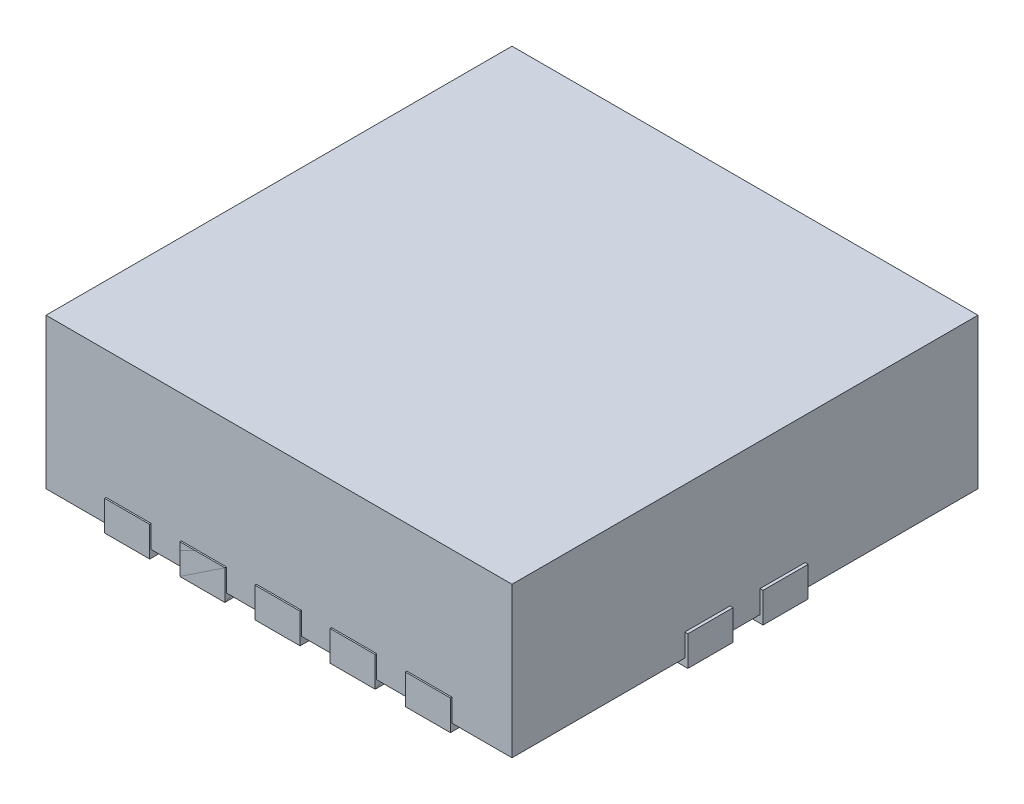
from build123d import *

# Parameters (mm, degrees)
SKETCH1_W            = 3.1
SKETCH1_H            = 3.1
BOSS_EXTRUDE1_DEPTH  = 1
BOSS_EXTRUDE2_START  = 0.05
BOSS_EXTRUDE2_DEPTH  = 0.2
BOSS_EXTRUDE3_START  = 0.05
BOSS_EXTRUDE3_DEPTH  = 0.2
BOSS_EXTRUDE4_START  = 0.05
BOSS_EXTRUDE4_DEPTH  = 0.2
LPATTERN3_COUNT      = 2
LPATTERN3_PITCH      = 0.5
MIRROR7_START        = 0.05
MIRROR7_COPY_1_DEPTH = 0.2
LPATTERN4_START      = -0.05
LPATTERN4_DEPTH      = 0.2
LPATTERN4_2_DEPTH    = 0.2
LPATTERN4_3_DEPTH    = 0.2
LPATTERN4_4_DEPTH    = 0.2
LPATTERN4_5_DEPTH    = 0.2
LPATTERN4_6_DEPTH    = 0.2
LPATTERN4_7_DEPTH    = 0.2
LPATTERN4_8_DEPTH    = 0.2
LPATTERN5_START      = -0.05
LPATTERN5_DEPTH      = 0.2
LPATTERN5_2_DEPTH    = 0.2
LPATTERN5_3_DEPTH    = 0.2
LPATTERN5_4_DEPTH    = 0.2
LPATTERN5_5_DEPTH    = 0.2
LPATTERN5_6_DEPTH    = 0.2
LPATTERN5_7_DEPTH    = 0.2
LPATTERN5_8_DEPTH    = 0.2
BOSS_EXTRUDE5_DEPTH  = 0.05


# Read off the part's stored shape, not the designer's step: LPattern4, LPattern5
with BuildPart() as part:
    # Sketch1 → Boss-Extrude1 (new body)
    with BuildSketch(Plane(origin=(0, 0, 0), x_dir=(1, 0, 0), z_dir=(0, 1, 0))):
        with Locations((1.55, 1.55)):
            Rectangle(SKETCH1_W, SKETCH1_H)
    extrude(amount=BOSS_EXTRUDE1_DEPTH)


with BuildPart() as body_2:
    # Sketch2 → Boss-Extrude2 (new body)
    with BuildSketch(Plane.XZ.offset(BOSS_EXTRUDE2_START)):
        with BuildLine():
            Line((1.7, 0.01), (1.7, -0.4))
            ThreePointArc((1.7, -0.4), (1.55, -0.5), (1.4, -0.4))
            Line((1.4, -0.4), (1.4, 0.01))
            Line((1.4, 0.01), (1.7, 0.01))
        make_face()
    extrude(amount=-BOSS_EXTRUDE2_DEPTH)


with BuildPart() as body_3:
    # Sketch4 → Boss-Extrude3 (new body)
    with BuildSketch(Plane.XZ.offset(BOSS_EXTRUDE3_START)):
        with BuildLine():
            Line((1.4, -3.11), (1.4, -2.7))
            ThreePointArc((1.4, -2.7), (1.55, -2.6), (1.7, -2.7))
            Line((1.7, -2.7), (1.7, -3.11))
            Line((1.7, -3.11), (1.4, -3.11))
        make_face()
    extrude(amount=-BOSS_EXTRUDE3_DEPTH)


with BuildPart() as body_4:
    # Sketch5 → Boss-Extrude4 (new body)
    with BuildSketch(Plane.XZ.offset(BOSS_EXTRUDE4_START)):
        with BuildLine():
            Line((-0.01, -1.15), (0.4, -1.15))
            ThreePointArc((0.4, -1.15), (0.5, -1.3), (0.4, -1.45))
            Line((0.4, -1.45), (-0.01, -1.45))
            Line((-0.01, -1.45), (-0.01, -1.15))
        make_face()
    boss_extrude4 = extrude(amount=-BOSS_EXTRUDE4_DEPTH)


with BuildPart() as lpattern3_1:
    # LPattern3: Boss-Extrude4 ×2
    with Locations(*[(0, 0, -i * LPATTERN3_PITCH) for i in range(1, LPATTERN3_COUNT)]):
        add(boss_extrude4)


with BuildPart() as part_1:
    add(part.part)

    # Mirror7: Boss-Extrude4 across plane
    add(boss_extrude4.mirror(Plane(origin=(1.555, 0, 0), x_dir=(0, 0, 1), z_dir=(1, 0, 0))))

    # Mirror7 copy 1 sketch → Mirror7 copy 1 (add)
    with BuildSketch(Plane(origin=(3.11, 0, -0.5), x_dir=(-1, 0, 0), z_dir=(0, -1, 0)).offset(MIRROR7_START)):
        with BuildLine():
            Line((-0.01, 1.15), (0.4, 1.15))
            ThreePointArc((0.4, 1.15), (0.5, 1.3), (0.4, 1.45))
            Line((0.4, 1.45), (-0.01, 1.45))
            Line((-0.01, 1.45), (-0.01, 1.15))
        make_face()
    extrude(amount=-MIRROR7_COPY_1_DEPTH)

    add(body_4.part)  # Boss-Extrude5 merges body 4

    add(lpattern3_1.part)  # Boss-Extrude5 merges LPattern3_1
    # Sketch6 → Boss-Extrude5 (add)
    with BuildSketch(Plane.XZ):
        Polygon((0.684601229, -0.725), (0.355, -1.054601229), (0.355, -2.375), (2.755, -2.375), (2.755, -0.725), (1.555, -0.725), align=None)
    extrude(amount=BOSS_EXTRUDE5_DEPTH)


with BuildPart() as body_6:
    # LPattern4 outline → LPattern4 (new body)
    with BuildSketch(Plane(origin=(0, 0, 0), x_dir=(1, 0, 0), z_dir=(0, 1, 0)).offset(LPATTERN4_START)):
        with BuildLine():
            ThreePointArc((2.2, 0.4), (2.05, 0.5), (1.9, 0.4))
            Line((1.9, 0.4), (1.9, -0.01))
            Line((1.9, -0.01), (2.2, -0.01))
            Line((2.2, -0.01), (2.2, 0.4))
        make_face()
    extrude(amount=LPATTERN4_DEPTH)


with BuildPart() as body_7:
    # LPattern4 2 outline → LPattern4 2 (new body)
    with BuildSketch(Plane(origin=(0, 0, 0), x_dir=(1, 0, 0), z_dir=(0, 1, 0)).offset(LPATTERN4_START)):
        with BuildLine():
            ThreePointArc((2.7, 0.4), (2.55, 0.5), (2.4, 0.4))
            Line((2.4, 0.4), (2.4, -0.01))
            Line((2.4, -0.01), (2.7, -0.01))
            Line((2.7, -0.01), (2.7, 0.4))
        make_face()
    extrude(amount=LPATTERN4_2_DEPTH)


with BuildPart() as body_8:
    # LPattern4 3 outline → LPattern4 3 (new body)
    with BuildSketch(Plane(origin=(0, 0, 0), x_dir=(1, 0, 0), z_dir=(0, 1, 0)).offset(LPATTERN4_START)):
        with BuildLine():
            ThreePointArc((1.2, 0.4), (1.05, 0.5), (0.9, 0.4))
            Line((0.9, 0.4), (0.9, -0.01))
            Line((0.9, -0.01), (1.2, -0.01))
            Line((1.2, -0.01), (1.2, 0.4))
        make_face()
    extrude(amount=LPATTERN4_3_DEPTH)


with BuildPart() as body_9:
    # LPattern4 4 outline → LPattern4 4 (new body)
    with BuildSketch(Plane(origin=(0, 0, 0), x_dir=(1, 0, 0), z_dir=(0, 1, 0)).offset(LPATTERN4_START)):
        with BuildLine():
            ThreePointArc((1.7, 0.4), (1.55, 0.5), (1.4, 0.4))
            Line((1.4, 0.4), (1.4, -0.01))
            Line((1.4, -0.01), (1.7, -0.01))
            Line((1.7, -0.01), (1.7, 0.4))
        make_face()
    extrude(amount=LPATTERN4_4_DEPTH)


with BuildPart() as body_10:
    # LPattern4 5 outline → LPattern4 5 (new body)
    with BuildSketch(Plane(origin=(0, 0, 0), x_dir=(1, 0, 0), z_dir=(0, 1, 0)).offset(LPATTERN4_START)):
        with BuildLine():
            ThreePointArc((2.2, 0.4), (2.05, 0.5), (1.9, 0.4))
            Line((1.9, 0.4), (1.9, -0.01))
            Line((1.9, -0.01), (2.2, -0.01))
            Line((2.2, -0.01), (2.2, 0.4))
        make_face()
    extrude(amount=LPATTERN4_5_DEPTH)


with BuildPart() as body_11:
    # LPattern4 6 outline → LPattern4 6 (new body)
    with BuildSketch(Plane(origin=(0, 0, 0), x_dir=(1, 0, 0), z_dir=(0, 1, 0)).offset(LPATTERN4_START)):
        with BuildLine():
            ThreePointArc((0.7, 0.4), (0.55, 0.5), (0.4, 0.4))
            Line((0.4, 0.4), (0.4, -0.01))
            Line((0.4, -0.01), (0.7, -0.01))
            Line((0.7, -0.01), (0.7, 0.4))
        make_face()
    extrude(amount=LPATTERN4_6_DEPTH)


with BuildPart() as body_12:
    # LPattern4 7 outline → LPattern4 7 (new body)
    with BuildSketch(Plane(origin=(0, 0, 0), x_dir=(1, 0, 0), z_dir=(0, 1, 0)).offset(LPATTERN4_START)):
        with BuildLine():
            ThreePointArc((1.2, 0.4), (1.05, 0.5), (0.9, 0.4))
            Line((0.9, 0.4), (0.9, -0.01))
            Line((0.9, -0.01), (1.2, -0.01))
            Line((1.2, -0.01), (1.2, 0.4))
        make_face()
    extrude(amount=LPATTERN4_7_DEPTH)


with BuildPart() as body_13:
    # LPattern4 8 outline → LPattern4 8 (new body)
    with BuildSketch(Plane(origin=(0, 0, 0), x_dir=(1, 0, 0), z_dir=(0, 1, 0)).offset(LPATTERN4_START)):
        with BuildLine():
            ThreePointArc((1.7, 0.4), (1.55, 0.5), (1.4, 0.4))
            Line((1.4, 0.4), (1.4, -0.01))
            Line((1.4, -0.01), (1.7, -0.01))
            Line((1.7, -0.01), (1.7, 0.4))
        make_face()
    extrude(amount=LPATTERN4_8_DEPTH)


with BuildPart() as body_14:
    # LPattern5 outline → LPattern5 (new body)
    with BuildSketch(Plane(origin=(0, 0, 0), x_dir=(1, 0, 0), z_dir=(0, 1, 0)).offset(LPATTERN5_START)):
        with BuildLine():
            ThreePointArc((1.9, 2.7), (2.05, 2.6), (2.2, 2.7))
            Line((2.2, 2.7), (2.2, 3.11))
            Line((2.2, 3.11), (1.9, 3.11))
            Line((1.9, 3.11), (1.9, 2.7))
        make_face()
    extrude(amount=LPATTERN5_DEPTH)


with BuildPart() as body_15:
    # LPattern5 2 outline → LPattern5 2 (new body)
    with BuildSketch(Plane(origin=(0, 0, 0), x_dir=(1, 0, 0), z_dir=(0, 1, 0)).offset(LPATTERN5_START)):
        with BuildLine():
            ThreePointArc((2.4, 2.7), (2.55, 2.6), (2.7, 2.7))
            Line((2.7, 2.7), (2.7, 3.11))
            Line((2.7, 3.11), (2.4, 3.11))
            Line((2.4, 3.11), (2.4, 2.7))
        make_face()
    extrude(amount=LPATTERN5_2_DEPTH)


with BuildPart() as body_16:
    # LPattern5 3 outline → LPattern5 3 (new body)
    with BuildSketch(Plane(origin=(0, 0, 0), x_dir=(1, 0, 0), z_dir=(0, 1, 0)).offset(LPATTERN5_START)):
        with BuildLine():
            ThreePointArc((0.9, 2.7), (1.05, 2.6), (1.2, 2.7))
            Line((1.2, 2.7), (1.2, 3.11))
            Line((1.2, 3.11), (0.9, 3.11))
            Line((0.9, 3.11), (0.9, 2.7))
        make_face()
    extrude(amount=LPATTERN5_3_DEPTH)


with BuildPart() as body_17:
    # LPattern5 4 outline → LPattern5 4 (new body)
    with BuildSketch(Plane(origin=(0, 0, 0), x_dir=(1, 0, 0), z_dir=(0, 1, 0)).offset(LPATTERN5_START)):
        with BuildLine():
            ThreePointArc((1.4, 2.7), (1.55, 2.6), (1.7, 2.7))
            Line((1.7, 2.7), (1.7, 3.11))
            Line((1.7, 3.11), (1.4, 3.11))
            Line((1.4, 3.11), (1.4, 2.7))
        make_face()
    extrude(amount=LPATTERN5_4_DEPTH)


with BuildPart() as body_18:
    # LPattern5 5 outline → LPattern5 5 (new body)
    with BuildSketch(Plane(origin=(0, 0, 0), x_dir=(1, 0, 0), z_dir=(0, 1, 0)).offset(LPATTERN5_START)):
        with BuildLine():
            ThreePointArc((1.9, 2.7), (2.05, 2.6), (2.2, 2.7))
            Line((2.2, 2.7), (2.2, 3.11))
            Line((2.2, 3.11), (1.9, 3.11))
            Line((1.9, 3.11), (1.9, 2.7))
        make_face()
    extrude(amount=LPATTERN5_5_DEPTH)


with BuildPart() as body_19:
    # LPattern5 6 outline → LPattern5 6 (new body)
    with BuildSketch(Plane(origin=(0, 0, 0), x_dir=(1, 0, 0), z_dir=(0, 1, 0)).offset(LPATTERN5_START)):
        with BuildLine():
            ThreePointArc((0.4, 2.7), (0.55, 2.6), (0.7, 2.7))
            Line((0.7, 2.7), (0.7, 3.11))
            Line((0.7, 3.11), (0.4, 3.11))
            Line((0.4, 3.11), (0.4, 2.7))
        make_face()
    extrude(amount=LPATTERN5_6_DEPTH)


with BuildPart() as body_20:
    # LPattern5 7 outline → LPattern5 7 (new body)
    with BuildSketch(Plane(origin=(0, 0, 0), x_dir=(1, 0, 0), z_dir=(0, 1, 0)).offset(LPATTERN5_START)):
        with BuildLine():
            ThreePointArc((0.9, 2.7), (1.05, 2.6), (1.2, 2.7))
            Line((1.2, 2.7), (1.2, 3.11))
            Line((1.2, 3.11), (0.9, 3.11))
            Line((0.9, 3.11), (0.9, 2.7))
        make_face()
    extrude(amount=LPATTERN5_7_DEPTH)


with BuildPart() as body_21:
    # LPattern5 8 outline → LPattern5 8 (new body)
    with BuildSketch(Plane(origin=(0, 0, 0), x_dir=(1, 0, 0), z_dir=(0, 1, 0)).offset(LPATTERN5_START)):
        with BuildLine():
            ThreePointArc((1.4, 2.7), (1.55, 2.6), (1.7, 2.7))
            Line((1.7, 2.7), (1.7, 3.11))
            Line((1.7, 3.11), (1.4, 3.11))
            Line((1.4, 3.11), (1.4, 2.7))
        make_face()
    extrude(amount=LPATTERN5_8_DEPTH)


solid = Compound([body_2.part, body_3.part, part_1.part, body_6.part, body_7.part, body_8.part, body_9.part, body_10.part, body_11.part, body_12.part, body_13.part, body_14.part, body_15.part, body_16.part, body_17.part, body_18.part, body_19.part, body_20.part, body_21.part])
